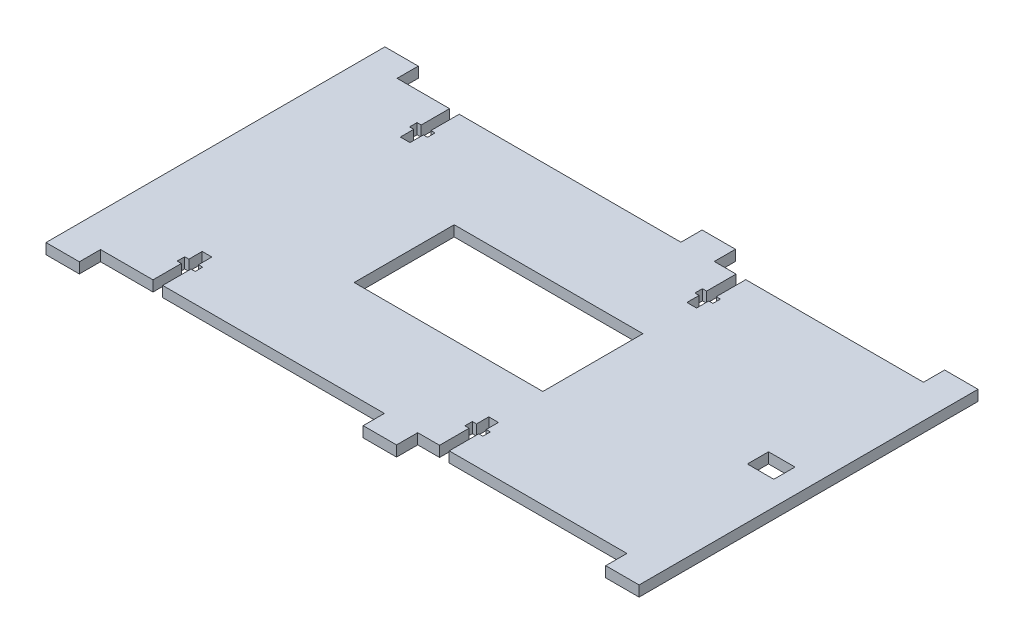
from build123d import *

# Parameters (mm, degrees)
SKETCH1_W      = 7.9375
SKETCH1_H      = 6.35
SKETCH1_W_2    = 56.575755521
SKETCH1_H_2    = 30
EXTRUDE1_DEPTH = 3.175


with BuildPart() as part:
    # Sketch1 → Extrude1 (new body)
    with BuildSketch(Plane(origin=(0, 0, 0), x_dir=(1, 0, 0), z_dir=(0, 1, 0))):
        Polygon((-64.258636898, 70.484310302), (-67.158636898, 70.484310302), (-67.158636898, 74.492800404), (-68.408636898, 74.492800404), (-68.408636898, 76.742800404), (-67.158636898, 76.742800404), (-67.158636898, 85.234310302), (-82.88813161, 85.234310302), (-82.88813161, 91.584310302), (-92.88813161, 91.584310302), (-92.88813161, -10.015689698), (-82.88813161, -10.015689698), (-82.88813161, -3.665689698), (-67.158636898, -3.665689698), (-67.158636898, 4.825820201), (-68.408636898, 4.825820201), (-68.408636898, 7.075820201), (-67.158636898, 7.075820201), (-67.158636898, 11.084310302), (-64.258636898, 11.084310302), (-64.258636898, 7.075820201), (-63.008636898, 7.075820201), (-63.008636898, 4.825820201), (-64.258636898, 4.825820201), (-64.258636898, -3.665689698), (2.20186839, -3.665689698), (2.20186839, -10.015689698), (12.20186839, -10.015689698), (12.20186839, -3.665689698), (18.744143558, -3.665689698), (18.744143558, 5.171032224), (17.494143558, 5.171032224), (17.494143558, 7.421032224), (18.744143558, 7.421032224), (18.744143558, 11.084310302), (21.644143558, 11.084310302), (21.644143558, 7.421032224), (22.894143558, 7.421032224), (22.894143558, 5.171032224), (21.644143558, 5.171032224), (21.644143558, -3.665689698), (74.914143558, -3.665689698), (74.914143558, -10.015689698), (84.914143558, -10.015689698), (84.914143558, 91.584310302), (74.914143558, 91.584310302), (74.914143558, 85.234310302), (21.644143558, 85.234310302), (21.644143558, 76.397588381), (22.894143558, 76.397588381), (22.894143558, 74.147588381), (21.644143558, 74.147588381), (21.644143558, 70.484310302), (18.744143558, 70.484310302), (18.744143558, 74.147588381), (17.494143558, 74.147588381), (17.494143558, 76.397588381), (18.744143558, 76.397588381), (18.744143558, 85.234310302), (12.20186839, 85.234310302), (12.20186839, 91.584310302), (2.20186839, 91.584310302), (2.20186839, 85.234310302), (-64.258636898, 85.234310302), (-64.258636898, 76.742800404), (-63.008636898, 76.742800404), (-63.008636898, 74.492800404), (-64.258636898, 74.492800404), align=None)
        with Locations((73.709900913, 40.784310302)):
            Rectangle(SKETCH1_W, SKETCH1_H, mode=Mode.SUBTRACT)
        with Locations((-8.02811942, 40.784310302)):
            Rectangle(SKETCH1_W_2, SKETCH1_H_2, mode=Mode.SUBTRACT)
    extrude(amount=EXTRUDE1_DEPTH)


solid = part.part
